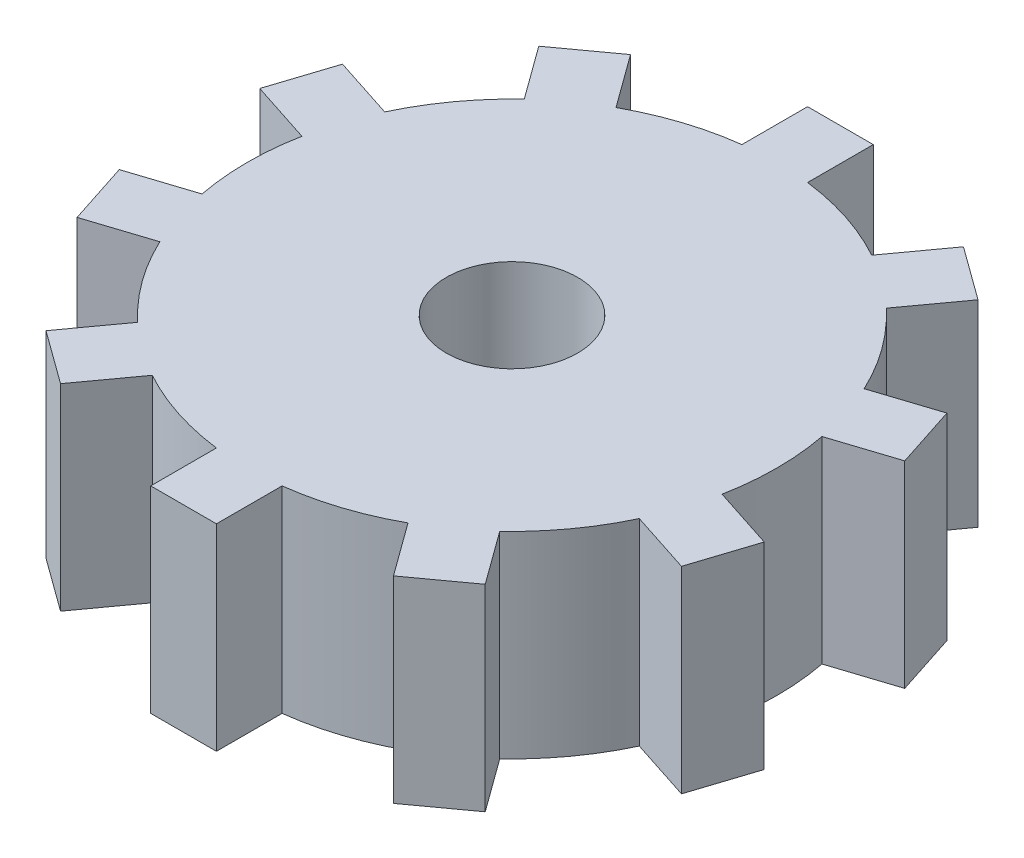
from build123d import *

# Parameters (mm, degrees)
SKETCH_1_R      = 10
EXTRUDE_1_DEPTH = 30


with BuildPart() as part:
    # 草圖1 → 填料-伸長1 (new body)
    with BuildSketch(Plane(origin=(0, 0, 0), x_dir=(1, 0, 0), z_dir=(0, 1, 0))):
        with BuildLine():
            Line((27.556495064, 29.421753514), (33.434347586, 37.511923457))
            Line((33.434347586, 37.511923457), (25.344177643, 43.38977598))
            Line((25.344177643, 43.38977598), (19.46632512, 35.299606036))
            ThreePointArc((19.46632512, 35.299606036), (12.456873286, 38.338313838), (5, 40))
            Line((5, 40), (5, 50))
            Line((5, 50), (-5, 50))
            Line((-5, 50), (-5, 40))
            ThreePointArc((-5, 40), (-12.456873286, 38.338313838), (-19.46632512, 35.299606036))
            Line((-19.46632512, 35.299606036), (-25.344177643, 43.38977598))
            Line((-25.344177643, 43.38977598), (-33.434347586, 37.511923457))
            Line((-33.434347586, 37.511923457), (-27.556495064, 29.421753514))
            ThreePointArc((-27.556495064, 29.421753514), (-32.612517657, 23.694381023), (-36.49717568, 17.115962356))
            Line((-36.49717568, 17.115962356), (-46.007740843, 20.2061323))
            Line((-46.007740843, 20.2061323), (-49.097910787, 10.695567137))
            Line((-49.097910787, 10.695567137), (-39.587345624, 7.605397194))
            ThreePointArc((-39.587345624, 7.605397194), (-40.311288741, 0), (-39.587345624, -7.605397194))
            Line((-39.587345624, -7.605397194), (-49.097910787, -10.695567137))
            Line((-49.097910787, -10.695567137), (-46.007740843, -20.2061323))
            Line((-46.007740843, -20.2061323), (-36.49717568, -17.115962356))
            ThreePointArc((-36.49717568, -17.115962356), (-32.612517657, -23.694381023), (-27.556495064, -29.421753514))
            Line((-27.556495064, -29.421753514), (-33.434347586, -37.511923457))
            Line((-33.434347586, -37.511923457), (-25.344177643, -43.38977598))
            Line((-25.344177643, -43.38977598), (-19.46632512, -35.299606036))
            ThreePointArc((-19.46632512, -35.299606036), (-12.456873286, -38.338313838), (-5, -40))
            Line((-5, -40), (-5, -50))
            Line((-5, -50), (5, -50))
            Line((5, -50), (5, -40))
            ThreePointArc((5, -40), (12.456873286, -38.338313838), (19.46632512, -35.299606036))
            Line((19.46632512, -35.299606036), (25.344177643, -43.38977598))
            Line((25.344177643, -43.38977598), (33.434347586, -37.511923457))
            Line((33.434347586, -37.511923457), (27.556495064, -29.421753514))
            ThreePointArc((27.556495064, -29.421753514), (32.612517657, -23.694381023), (36.49717568, -17.115962356))
            Line((36.49717568, -17.115962356), (46.007740843, -20.2061323))
            Line((46.007740843, -20.2061323), (49.097910787, -10.695567137))
            Line((49.097910787, -10.695567137), (39.587345624, -7.605397194))
            ThreePointArc((39.587345624, -7.605397194), (40.311288741, 0), (39.587345624, 7.605397194))
            Line((39.587345624, 7.605397194), (49.097910787, 10.695567137))
            Line((49.097910787, 10.695567137), (46.007740843, 20.2061323))
            Line((46.007740843, 20.2061323), (36.49717568, 17.115962356))
            ThreePointArc((36.49717568, 17.115962356), (32.612517657, 23.694381023), (27.556495064, 29.421753514))
        make_face()
        Circle(SKETCH_1_R, mode=Mode.SUBTRACT)
    extrude(amount=EXTRUDE_1_DEPTH)


solid = part.part
